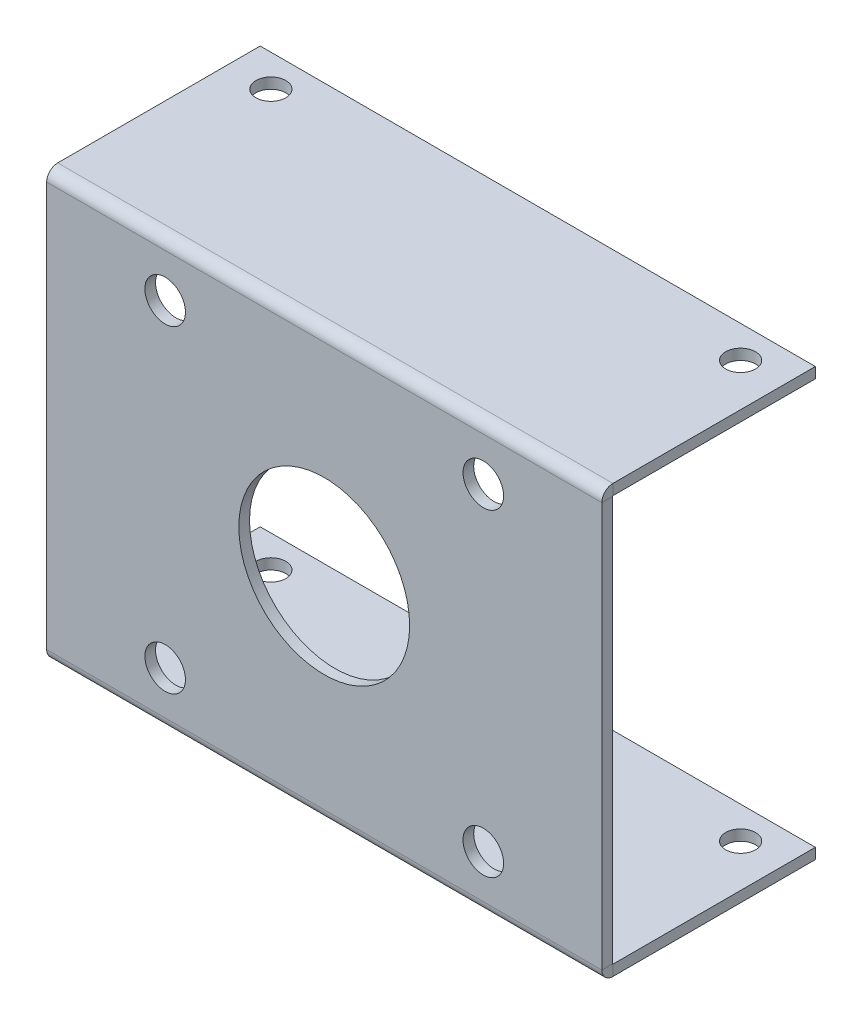
from build123d import *

# Parameters (mm, degrees)
SKETCH1_W                    = 260
SKETCH1_H                    = 200
BASE_FLANGE1_DEPTH           = 5
EDGE_FLANGE1_STRIP_W         = 20.4
EDGE_FLANGE1_STRIP_H         = 5
EDGE_FLANGE1_STRIP_CUT_DEPTH = 260
EDGE_FLANGE1_DEPTH           = 260
EDGE_FLANGE2_STRIP_W         = 20.4
EDGE_FLANGE2_STRIP_H         = 5
EDGE_FLANGE2_STRIP_CUT_DEPTH = 260
EDGE_FLANGE2_DEPTH           = 260
CUT_EXTRUDE1_DEPTH           = 193.093727123
CUT_EXTRUDE1_DEPTH_BACK      = 193.093727123
SKETCH12_R                   = 40
CUT_EXTRUDE2_DEPTH           = 193.093727123
CUT_EXTRUDE2_DEPTH_BACK      = 193.093727123
SKETCH13_R                   = 9.5
CUT_EXTRUDE3_DEPTH           = 259.650343128
CUT_EXTRUDE3_DEPTH_BACK      = 259.650343128
SKETCH14_R                   = 7


# Sheet-metal steps are written as plain solids
with BuildPart() as part:
    # Sketch1 → Base-Flange1 (new body)
    with BuildSketch(Plane.XY):
        Rectangle(SKETCH1_W, SKETCH1_H)
    extrude(amount=-BASE_FLANGE1_DEPTH)

    # Edge-Flange1 strip (across the edge) → Edge-Flange1 strip cut (cut)
    with BuildSketch(Plane(origin=(-130, 100, -5), x_dir=(0, -1, 0), z_dir=(1, 0, 0))):
        with Locations((-5, -2.5)):
            Rectangle(EDGE_FLANGE1_STRIP_W, EDGE_FLANGE1_STRIP_H)
    extrude(amount=EDGE_FLANGE1_STRIP_CUT_DEPTH, mode=Mode.SUBTRACT)

    # Edge-Flange1 section (across the edge) → Edge-Flange1 (add)
    with BuildSketch(Plane(origin=(-130, 100, -5), x_dir=(0, -1, 0), z_dir=(1, 0, 0))):
        with BuildLine():
            Line((0, 0.2), (0, 95))
            Line((0, 95), (5, 95))
            Line((5, 95), (5, 0.2))
            ThreePointArc((5, 0.2), (5.058578644, 0.058578644), (5.2, 0))
            Line((5.2, 0), (5.2, -5))
            ThreePointArc((5.2, -5), (1.523044738, -3.476955262), (0, 0.2))
        make_face()
    extrude(amount=EDGE_FLANGE1_DEPTH)

    # Edge-Flange2 strip (across the edge) → Edge-Flange2 strip cut (cut)
    with BuildSketch(Plane(origin=(130, -100, -5), x_dir=(0, 1, 0), z_dir=(-1, 0, 0))):
        with Locations((-5, -2.5)):
            Rectangle(EDGE_FLANGE2_STRIP_W, EDGE_FLANGE2_STRIP_H)
    extrude(amount=EDGE_FLANGE2_STRIP_CUT_DEPTH, mode=Mode.SUBTRACT)

    # Edge-Flange2 section (across the edge) → Edge-Flange2 (add)
    with BuildSketch(Plane(origin=(130, -100, -5), x_dir=(0, 1, 0), z_dir=(-1, 0, 0))):
        with BuildLine():
            Line((0, 0.2), (0, 95))
            Line((0, 95), (5, 95))
            Line((5, 95), (5, 0.2))
            ThreePointArc((5, 0.2), (5.058578644, 0.058578644), (5.2, 0))
            Line((5.2, 0), (5.2, -5))
            ThreePointArc((5.2, -5), (1.523044738, -3.476955262), (0, 0.2))
        make_face()
    extrude(amount=EDGE_FLANGE2_DEPTH)

    # Sketch12 → Cut-Extrude1 (cut, two sides: drawn at the far end of the back side and taken through both)
    with BuildSketch(Plane.XY.offset(-CUT_EXTRUDE1_DEPTH_BACK)):
        with Locations(Location((0, 0, 0), (0, 0, 180))):
            Circle(SKETCH12_R)
    extrude(amount=CUT_EXTRUDE1_DEPTH + CUT_EXTRUDE1_DEPTH_BACK, mode=Mode.SUBTRACT)

    # Sketch13 → Cut-Extrude2 (cut, two sides: drawn at the far end of the back side and taken through both)
    with BuildSketch(Plane.XY.offset(-CUT_EXTRUDE2_DEPTH_BACK)):
        with Locations(Location((74.5, 74.5, 0), (0, 0, 180))):
            Circle(SKETCH13_R)
        with Locations(Location((-74.5, 74.5, 0), (0, 0, 180))):
            Circle(SKETCH13_R)
        with Locations(Location((-74.5, -74.5, 0), (0, 0, 180))):
            Circle(SKETCH13_R)
        with Locations(Location((74.5, -74.5, 0), (0, 0, 180))):
            Circle(SKETCH13_R)
    extrude(amount=CUT_EXTRUDE2_DEPTH + CUT_EXTRUDE2_DEPTH_BACK, mode=Mode.SUBTRACT)

    # Sketch14 → Cut-Extrude3 (cut, two sides: drawn at the far end of the back side and taken through both)
    with BuildSketch(Plane(origin=(0, -100, 0), x_dir=(-1, 0, 0), z_dir=(0, -1, 0)).offset(-CUT_EXTRUDE3_DEPTH_BACK)):
        with Locations(Location((110, 85, 0), (0, 0, 270))):
            Circle(SKETCH14_R)
        with Locations(Location((-110, 85, 0), (0, 0, 270))):
            Circle(SKETCH14_R)
    extrude(amount=CUT_EXTRUDE3_DEPTH + CUT_EXTRUDE3_DEPTH_BACK, mode=Mode.SUBTRACT)


solid = part.part
